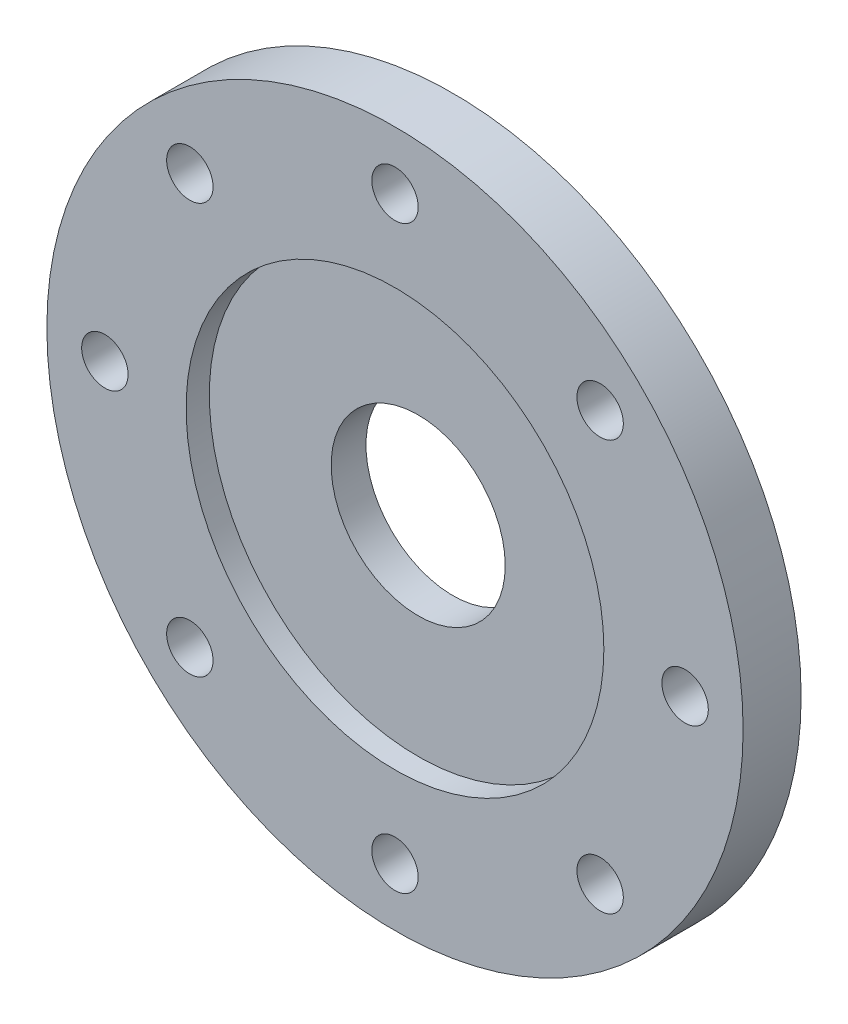
from build123d import *

# Parameters (mm, degrees)
SKETCH1_R           = 19.05
SKETCH1_R_2         = 1.27
SKETCH1_R_3         = 4.7625
BOSS_EXTRUDE1_DEPTH = 3.175
SKETCH2_R           = 11.43
CUT_EXTRUDE1_DEPTH  = 1.27


with BuildPart() as part:
    # Sketch1 → Boss-Extrude1 (new body)
    with BuildSketch(Plane.XY):
        Circle(SKETCH1_R)
        with Locations((0, 15.875)):
            Circle(SKETCH1_R_2, mode=Mode.SUBTRACT)
        with Locations((11.225320151, 11.225320151)):
            Circle(SKETCH1_R_2, mode=Mode.SUBTRACT)
        with Locations((15.875, 0)):
            Circle(SKETCH1_R_2, mode=Mode.SUBTRACT)
        Circle(SKETCH1_R_3, mode=Mode.SUBTRACT)
        with Locations((11.225320151, -11.225320151)):
            Circle(SKETCH1_R_2, mode=Mode.SUBTRACT)
        with Locations((0, -15.875)):
            Circle(SKETCH1_R_2, mode=Mode.SUBTRACT)
        with Locations((-11.225320151, -11.225320151)):
            Circle(SKETCH1_R_2, mode=Mode.SUBTRACT)
        with Locations((-15.875, 0)):
            Circle(SKETCH1_R_2, mode=Mode.SUBTRACT)
        with Locations((-11.225320151, 11.225320151)):
            Circle(SKETCH1_R_2, mode=Mode.SUBTRACT)
    extrude(amount=BOSS_EXTRUDE1_DEPTH)

    # Sketch2 → Cut-Extrude1 (cut)
    with BuildSketch(Plane.XY.offset(3.175)):
        Circle(SKETCH2_R)
    extrude(amount=-CUT_EXTRUDE1_DEPTH, mode=Mode.SUBTRACT)


solid = part.part
